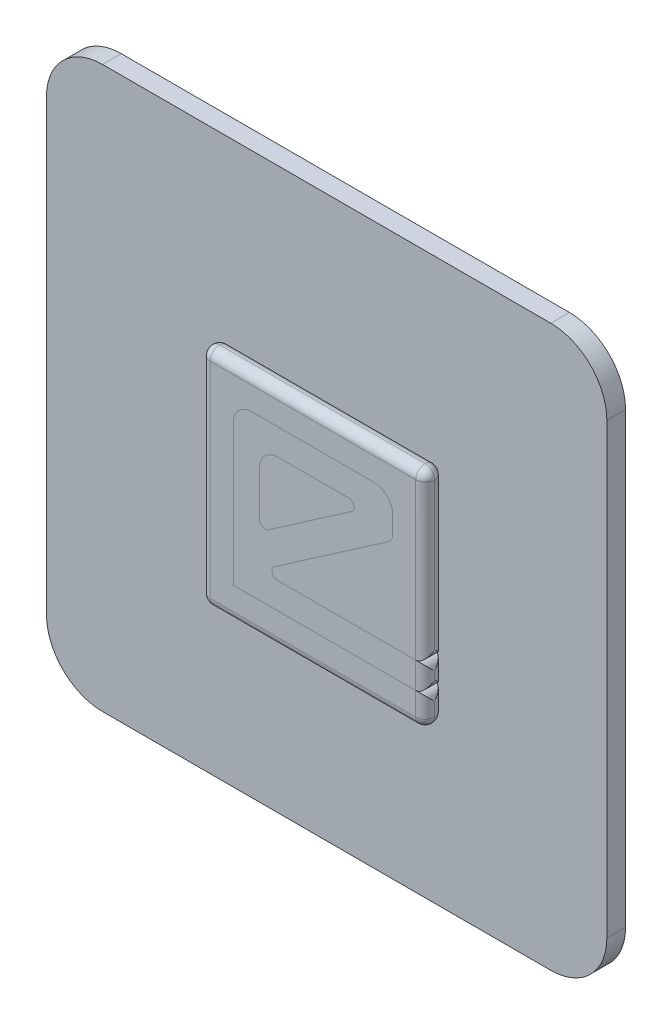
from build123d import *

# Parameters (mm, degrees)
BOSS_EXTRUDE1_DEPTH   = 10
BOSS_EXTRUDE2_DEPTH   = 10
BOSS_EXTRUDE2_2_DEPTH = 10
BOSS_EXTRUDE3_DEPTH   = 10
FILLET1_R             = 5
FILLET2_R             = 5


with BuildPart() as part:
    # Sketch1 → Boss-Extrude1 (new body)
    with BuildSketch(Plane.XY):
        with BuildLine():
            Line((30, 0), (270, 0))
            ThreePointArc((270, 0), (291.213203436, 8.786796564), (300, 30))
            Line((300, 30), (300, 270))
            ThreePointArc((300, 270), (291.213203436, 291.213203436), (270, 300))
            Line((270, 300), (30, 300))
            ThreePointArc((30, 300), (8.786796564, 291.213203436), (0, 270))
            Line((0, 270), (0, 30))
            ThreePointArc((0, 30), (8.786796564, 8.786796564), (30, 0))
        make_face()
    extrude(amount=BOSS_EXTRUDE1_DEPTH)


with BuildPart() as body_2:
    # Sketch2 → Boss-Extrude2 (new body)
    with BuildSketch(Plane.XY.offset(10)):
        with BuildLine():
            Line((212.683257667, 86.270816378), (212.683257667, 103.605002094))
            Line((212.683257667, 103.605002094), (110.017443383, 103.605002094))
            Line((110.017443383, 103.605002094), (110.017443383, 178.936630662))
            ThreePointArc((110.017443383, 178.936630662), (112.946375571, 186.007698474), (120.017443383, 188.936630662))
            Line((120.017443383, 188.936630662), (185.349071951, 188.936630662))
            ThreePointArc((185.349071951, 188.936630662), (192.420139763, 186.007698474), (195.349071951, 178.936630662))
            Line((195.349071951, 178.936630662), (195.349071951, 169.500355881))
            ThreePointArc((195.349071951, 169.500355881), (194.776609718, 167.177230977), (193.190308222, 165.38606658))
            Line((193.190308222, 165.38606658), (131.974513591, 123.111806467))
            ThreePointArc((131.974513591, 123.111806467), (130.815191742, 119.750406123), (133.679255354, 117.643232887))
            Line((133.679255354, 117.643232887), (212.683257667, 117.643232887))
            Line((212.683257667, 117.643232887), (212.683257667, 206.270816378))
            Line((212.683257667, 206.270816378), (92.683257667, 206.270816378))
            Line((92.683257667, 206.270816378), (92.683257667, 86.270816378))
            Line((92.683257667, 86.270816378), (212.683257667, 86.270816378))
        make_face()
    extrude(amount=BOSS_EXTRUDE2_DEPTH)

    # Fillet1
    fillet1_edges = [body_2.edges().sort_by_distance(p)[0] for p in [
        (212.683257667, 94.937909236, 10),
        (152.683257667, 86.270816378, 10),
        (92.683257667, 146.270816378, 10),
        (152.683257667, 206.270816378, 10),
        (212.683257667, 161.957024632, 10),
        (212.683257667, 103.605002094, 15),
        (212.683257667, 86.270816378, 15),
        (92.683257667, 86.270816378, 15),
        (92.683257667, 206.270816378, 15),
        (212.683257667, 206.270816378, 15),
        (212.683257667, 117.643232887, 15),
        (212.683257667, 161.957024632, 20),
        (152.683257667, 206.270816378, 20),
        (92.683257667, 146.270816378, 20),
        (152.683257667, 86.270816378, 20),
        (212.683257667, 94.937909236, 20),
    ]]
    fillet(fillet1_edges, radius=FILLET1_R - 0.0001)  # a hair under: the kernel refuses the full size


with BuildPart() as body_3:
    # Sketch2 → Boss-Extrude2 2 (new body)
    with BuildSketch(Plane.XY.offset(10)):
        with BuildLine():
            Line((124.055674176, 164.898399869), (124.055674176, 141.076823854))
            ThreePointArc((124.055674176, 141.076823854), (125.661799233, 138.420301194), (128.760415939, 138.608250273))
            Line((128.760415939, 138.608250273), (173.392001743, 169.429826289))
            ThreePointArc((173.392001743, 169.429826289), (174.551323592, 172.791226633), (171.687259981, 174.898399869))
            Line((171.687259981, 174.898399869), (134.055674176, 174.898399869))
            ThreePointArc((134.055674176, 174.898399869), (126.984606364, 171.969467681), (124.055674176, 164.898399869))
        make_face()
    extrude(amount=BOSS_EXTRUDE2_2_DEPTH)


with BuildPart() as body_4:
    # Sketch2<3> → Boss-Extrude3 (new body)
    with BuildSketch(Plane.XY.offset(10)):
        with BuildLine():
            Line((110.017443383, 103.605002094), (212.683257667, 103.605002094))
            Line((212.683257667, 103.605002094), (212.683257667, 117.643232887))
            Line((212.683257667, 117.643232887), (133.679255354, 117.643232887))
            ThreePointArc((133.679255354, 117.643232887), (130.815191742, 119.750406123), (131.974513591, 123.111806467))
            Line((131.974513591, 123.111806467), (193.190308222, 165.38606658))
            ThreePointArc((193.190308222, 165.38606658), (194.776609718, 167.177230977), (195.349071951, 169.500355881))
            Line((195.349071951, 169.500355881), (195.349071951, 178.936630662))
            ThreePointArc((195.349071951, 178.936630662), (192.420139763, 186.007698474), (185.349071951, 188.936630662))
            Line((185.349071951, 188.936630662), (120.017443383, 188.936630662))
            ThreePointArc((120.017443383, 188.936630662), (112.946375571, 186.007698474), (110.017443383, 178.936630662))
            Line((110.017443383, 178.936630662), (110.017443383, 103.605002094))
        make_face()
        with BuildLine():
            ThreePointArc((128.760415939, 138.608250273), (125.661799233, 138.420301194), (124.055674176, 141.076823854))
            Line((124.055674176, 141.076823854), (124.055674176, 164.898399869))
            ThreePointArc((124.055674176, 164.898399869), (126.984606364, 171.969467681), (134.055674176, 174.898399869))
            Line((134.055674176, 174.898399869), (171.687259981, 174.898399869))
            ThreePointArc((171.687259981, 174.898399869), (174.551323592, 172.791226633), (173.392001743, 169.429826289))
            Line((173.392001743, 169.429826289), (128.760415939, 138.608250273))
        make_face(mode=Mode.SUBTRACT)
    extrude(amount=BOSS_EXTRUDE3_DEPTH)

    # Fillet2
    fillet2_edges = [body_4.edges().sort_by_distance(p)[0] for p in [
        (212.683257667, 110.62411749, 10),
        (212.683257667, 117.643232887, 15),
        (212.683257667, 103.605002094, 15),
        (212.683257667, 110.62411749, 20),
    ]]
    fillet(fillet2_edges, radius=FILLET2_R - 0.0001)  # a hair under: the kernel refuses the full size


solid = Compound([part.part, body_2.part, body_3.part, body_4.part])
